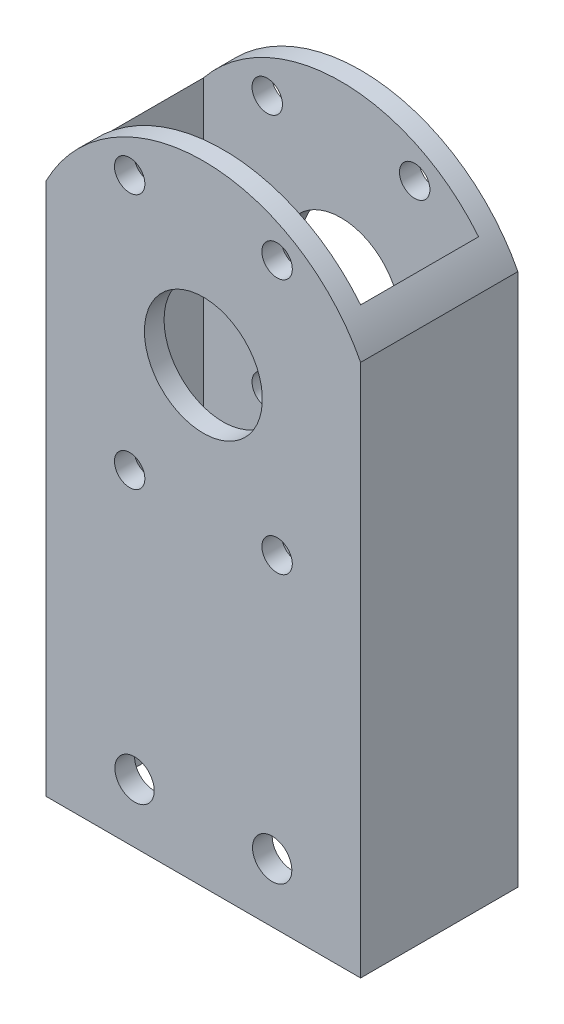
from build123d import *

# Parameters (mm, degrees)
SKETCH1_W                    = 50.8
SKETCH1_H                    = 25.4
SKETCH1_W_2                  = 44.45
SKETCH1_H_2                  = 19.05
EXTRUDE_THIN1_DEPTH          = 101.6
F_10_0_1935_DIAMETER_HOLE2_D = 4.9149
CUT_EXTRUDE2_DEPTH           = 108.763073453
CUT_EXTRUDE2_DEPTH_BACK      = 108.763073453
SKETCH7_R                    = 9.525
F_1_4_0_25_DIAMETER_HOLE1_D  = 6.35
CUT_EXTRUDE3_DEPTH           = 108.763073453


with BuildPart() as part:
    # Sketch1 → Extrude-Thin1 (new body)
    with BuildSketch(Plane(origin=(0, 0, 0), x_dir=(1, 0, 0), z_dir=(0, 1, 0))):
        Rectangle(SKETCH1_W, SKETCH1_H)
        Rectangle(SKETCH1_W_2, SKETCH1_H_2, mode=Mode.SUBTRACT)
    extrude(amount=EXTRUDE_THIN1_DEPTH)

    # #10 (0.1935) Diameter Hole2 (through all)
    with Locations(Plane(origin=(0, 0, -12.7), x_dir=(-1, 0, 0), z_dir=(0, 0, -1))):
        with Locations((-11.90625, 52.402770072), (-11.90625, 93.647229928), (11.90625, 93.647229928), (11.90625, 52.402770072)):
            Hole(F_10_0_1935_DIAMETER_HOLE2_D / 2)

    # Sketch7 → Cut-Extrude2 (cut, two sides: drawn at the far end of the back side and taken through both)
    with BuildSketch(Plane(origin=(0, 0, -12.7), x_dir=(-1, 0, 0), z_dir=(0, 0, -1)).offset(-CUT_EXTRUDE2_DEPTH_BACK)):
        with Locations((0, 73.025)):
            Circle(SKETCH7_R)
    extrude(amount=CUT_EXTRUDE2_DEPTH + CUT_EXTRUDE2_DEPTH_BACK, mode=Mode.SUBTRACT)

    # 1/4 (0.25) Diameter Hole1 (through all)
    with Locations(Plane.XY.offset(12.7)):
        with Locations((-11.1125, 9.525), (11.1125, 9.525), (-109.171479686, 68.785430569)):
            Hole(F_1_4_0_25_DIAMETER_HOLE1_D / 2)

    # Sketch10 → Cut-Extrude3 (cut, through all)
    with BuildSketch(Plane(origin=(0, 0, -12.7), x_dir=(-1, 0, 0), z_dir=(0, 0, -1))):
        with BuildLine():
            Line((25.4, 101.6), (0, 101.6))
            ThreePointArc((0, 101.6), (14.873790542, 97.423790542), (25.4, 86.115860361))
            Line((25.4, 86.115860361), (25.4, 101.6))
        make_face()
        with BuildLine():
            Line((-25.4, 101.6), (-25.4, 86.115860361))
            ThreePointArc((-25.4, 86.115860361), (-14.873790542, 97.423790542), (0, 101.6))
            Line((0, 101.6), (-25.4, 101.6))
        make_face()
    extrude(amount=-CUT_EXTRUDE3_DEPTH, mode=Mode.SUBTRACT)


solid = part.part
